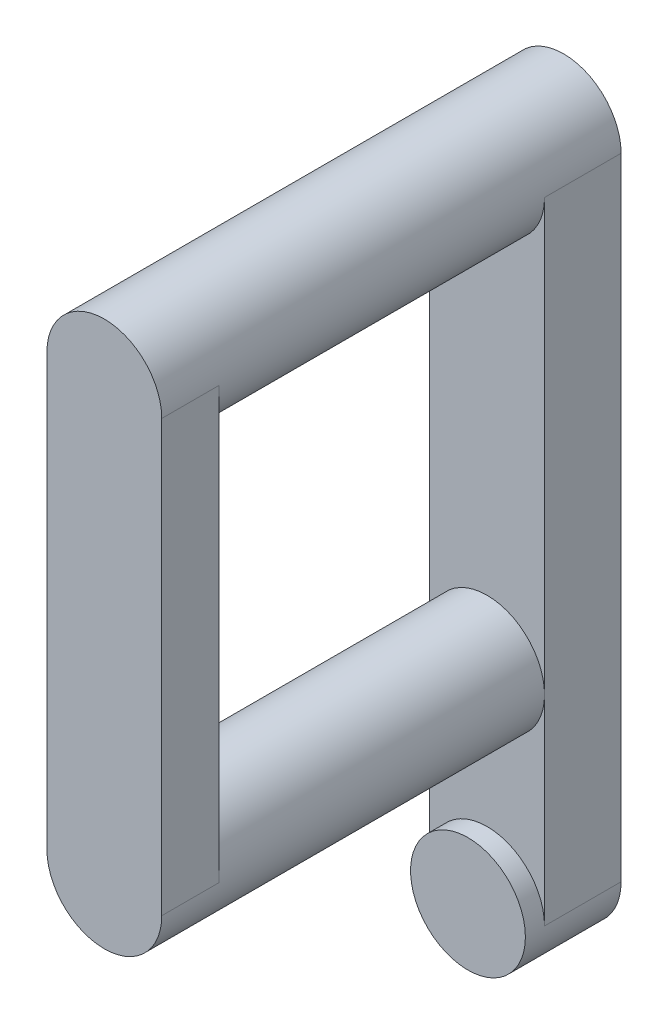
from build123d import *
from build123d.topology import SkipClean

# Parameters (mm, degrees)
AUFSATZ_LINEAR_AUSTRAGEN1_DEPTH = 4
SKIZZE2_R                       = 3
AUFSATZ_LINEAR_AUSTRAGEN2_DEPTH = 20
AUFSATZ_LINEAR_START            = -3
AUFSATZ_LINEAR_AUSTRAGEN3_DEPTH = 3
AUFSATZ_LINEAR_START_2          = -4
SKIZZE4_R                       = 3
AUFSATZ_LINEAR_AUSTRAGEN4_DEPTH = 5
SKIZZE5_R                       = 1.7
SCHNITT_LINEAR_AUSTRAGEN1_DEPTH = 4


with BuildPart() as part:
    # Skizze1 → Aufsatz-Linear austragen1 (new body)
    with BuildSketch(Plane.XY):
        with BuildLine():
            Line((43.5, -13.943887949), (43.5, -46.908717461))
            ThreePointArc((43.5, -46.908717461), (40.5, -49.908717461), (37.5, -46.908717461))
            Line((37.5, -46.908717461), (37.5, -13.943887949))
            ThreePointArc((37.5, -13.943887949), (40.5, -10.943887949), (43.5, -13.943887949))
        make_face()
    extrude(amount=AUFSATZ_LINEAR_AUSTRAGEN1_DEPTH)

    # Skizze2 → Aufsatz-Linear austragen2 (add)
    with SkipClean():  # the faces are left unmerged after this step: merging them gives an invalid solid
        with BuildSketch(Plane.XY.offset(4)):
            with Locations((40.5, -13.943887949)):
                Circle(SKIZZE2_R)
            with Locations(Location((40.5, -36.443887949, 0), (0, 0, 180))):
                Circle(SKIZZE2_R)
        extrude(amount=AUFSATZ_LINEAR_AUSTRAGEN2_DEPTH)
    add(part.part.scale(1), mode=Mode.REPLACE)  # the faces are merged on a copy

    # Skizze3 → Aufsatz-Linear austragen3 (add)
    with BuildSketch(Plane.XY.offset(24).offset(AUFSATZ_LINEAR_START)):
        with BuildLine():
            Line((43.5, -13.943887949), (43.5, -36.443887949))
            ThreePointArc((43.5, -36.443887949), (40.5, -39.443887949), (37.5, -36.443887949))
            Line((37.5, -36.443887949), (37.5, -13.943887949))
            ThreePointArc((37.5, -13.943887949), (40.5, -10.943887949), (43.5, -13.943887949))
        make_face()
    extrude(amount=AUFSATZ_LINEAR_AUSTRAGEN3_DEPTH)

    # Skizze4 → Aufsatz-Linear austragen4 (add)
    with BuildSketch(Plane.XY.offset(4).offset(AUFSATZ_LINEAR_START_2)):
        with Locations((40.5, -46.908717461)):
            Circle(SKIZZE4_R)
    extrude(amount=AUFSATZ_LINEAR_AUSTRAGEN4_DEPTH)

    # Skizze5 → Schnitt-Linear austragen1 (cut)
    with BuildSketch(Plane(origin=(0, 0, 0), x_dir=(-1, 0, 0), z_dir=(0, 0, -1))):
        with Locations((-40.5, -13.943887949)):
            Circle(SKIZZE5_R)
        with Locations(Location((-40.5, -46.908717461, 0), (0, 0, 180))):
            Circle(SKIZZE5_R)
    extrude(amount=-SCHNITT_LINEAR_AUSTRAGEN1_DEPTH, mode=Mode.SUBTRACT)


solid = part.part
